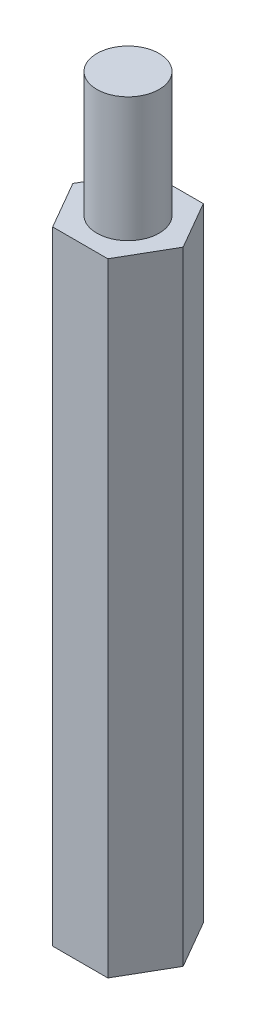
from build123d import *

# Parameters (mm, degrees)
EXTRUDE_1_DEPTH     = 30
SKETCH_2_R          = 1.5
EXTRUDE_2_DEPTH     = 6
SKETCH_3_R          = 1.5
CUT_EXTRUDE_1_DEPTH = 10


with BuildPart() as part:
    # 草图1 → 凸台-拉伸1 (new body)
    with BuildSketch(Plane(origin=(0, 0, 0), x_dir=(1, 0, 0), z_dir=(0, 1, 0))):
        Polygon((2.655811238, 0), (1.327905619, 2.3), (-1.327905619, 2.3), (-2.655811238, 0), (-1.327905619, -2.3), (1.327905619, -2.3), align=None)
    extrude(amount=EXTRUDE_1_DEPTH)

    # 草图2 → 凸台-拉伸2 (add)
    with BuildSketch(Plane(origin=(0, 30, 0), x_dir=(1, 0, 0), z_dir=(0, 1, 0))):
        Circle(SKETCH_2_R)
    extrude(amount=EXTRUDE_2_DEPTH)

    # 草图3 → 切除-拉伸1 (cut)
    with BuildSketch(Plane.XZ):
        Circle(SKETCH_3_R)
    extrude(amount=-CUT_EXTRUDE_1_DEPTH, mode=Mode.SUBTRACT)


solid = part.part
